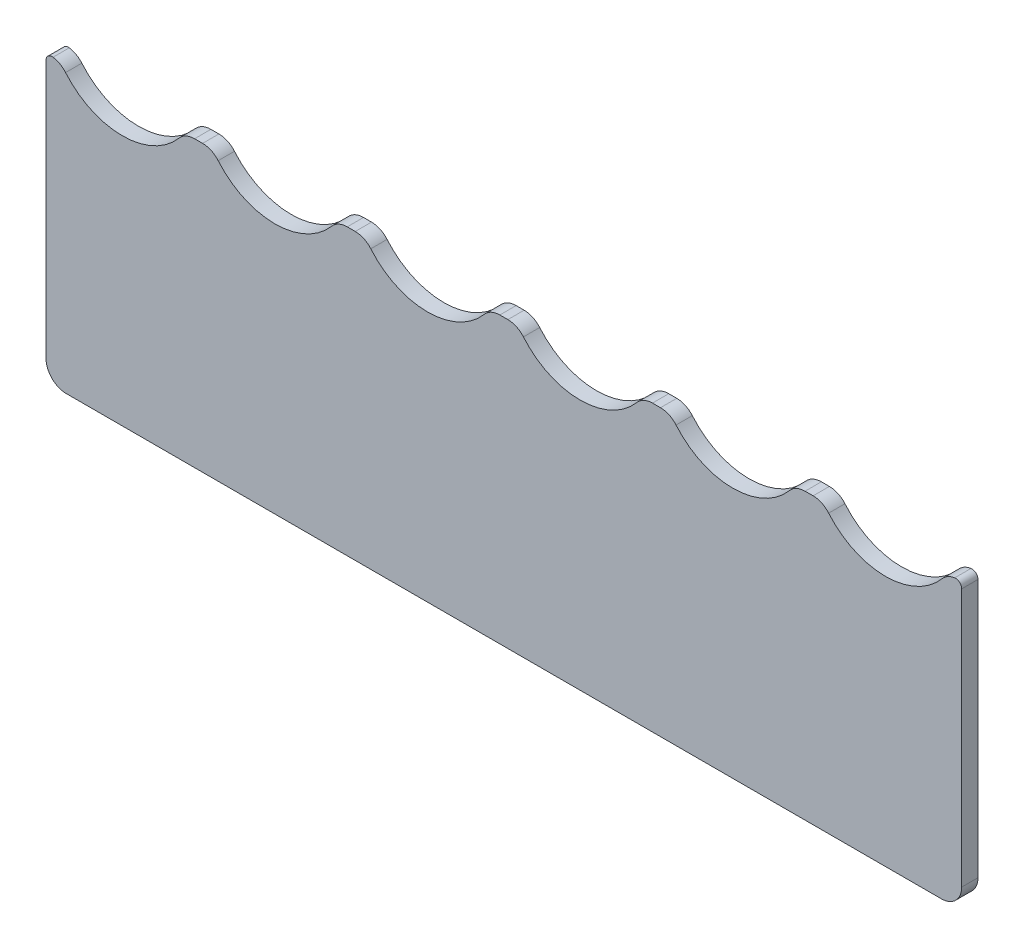
from build123d import *

# Parameters (mm, degrees)
ESQUISSE1_W                  = 450
ESQUISSE1_H                  = 140
BOSS_EXTRU_1_DEPTH           = 8
ENL_V_MAT_EXTRU_1_DEPTH      = 472.342762753
ENL_V_MAT_EXTRU_1_DEPTH_BACK = 472.342762753
ESQUISSE2_R                  = 36.5
CONG_1_R                     = 10
CONG_2_R                     = 3


with BuildPart() as part:
    # Esquisse1 → Boss.-Extru.1 (new body)
    with BuildSketch(Plane.XY):
        with Locations((225, 70)):
            Rectangle(ESQUISSE1_W, ESQUISSE1_H)
    extrude(amount=BOSS_EXTRU_1_DEPTH)

    # Esquisse2 → Enlèv. mat.-Extru.1 (cut, two sides: drawn at the far end of the back side and taken through both)
    with BuildSketch(Plane.XY.offset(8).offset(-ENL_V_MAT_EXTRU_1_DEPTH_BACK)):
        with Locations((187.5, 160)):
            Circle(ESQUISSE2_R)
        with Locations((112.5, 160)):
            Circle(ESQUISSE2_R)
        with Locations((37.5, 160)):
            Circle(ESQUISSE2_R)
        with Locations((412.5, 160)):
            Circle(ESQUISSE2_R)
        with Locations((337.5, 160)):
            Circle(ESQUISSE2_R)
        with Locations((262.5, 160)):
            Circle(ESQUISSE2_R)
    extrude(amount=ENL_V_MAT_EXTRU_1_DEPTH + ENL_V_MAT_EXTRU_1_DEPTH_BACK, mode=Mode.SUBTRACT)

    # Congé1
    cong_1_edges = [part.edges().sort_by_distance(p)[0] for p in [
        (6.967230718, 140, 4),
        (443.032769282, 140, 4),
        (381.967230718, 140, 4),
        (368.032769282, 140, 4),
        (306.967230718, 140, 4),
        (293.032769282, 140, 4),
        (231.967230718, 140, 4),
        (218.032769282, 140, 4),
        (156.967230718, 140, 4),
        (143.032769282, 140, 4),
        (81.967230718, 140, 4),
        (68.032769282, 140, 4),
        (450, 0, 4),
        (0, 0, 4),
    ]]
    fillet(cong_1_edges, radius=CONG_1_R)

    # Congé2
    cong_2_edges = [part.edges().sort_by_distance(p)[0] for p in [
        (450, 140, 4),
        (0, 140, 4),
    ]]
    fillet(cong_2_edges, radius=CONG_2_R)


solid = part.part
